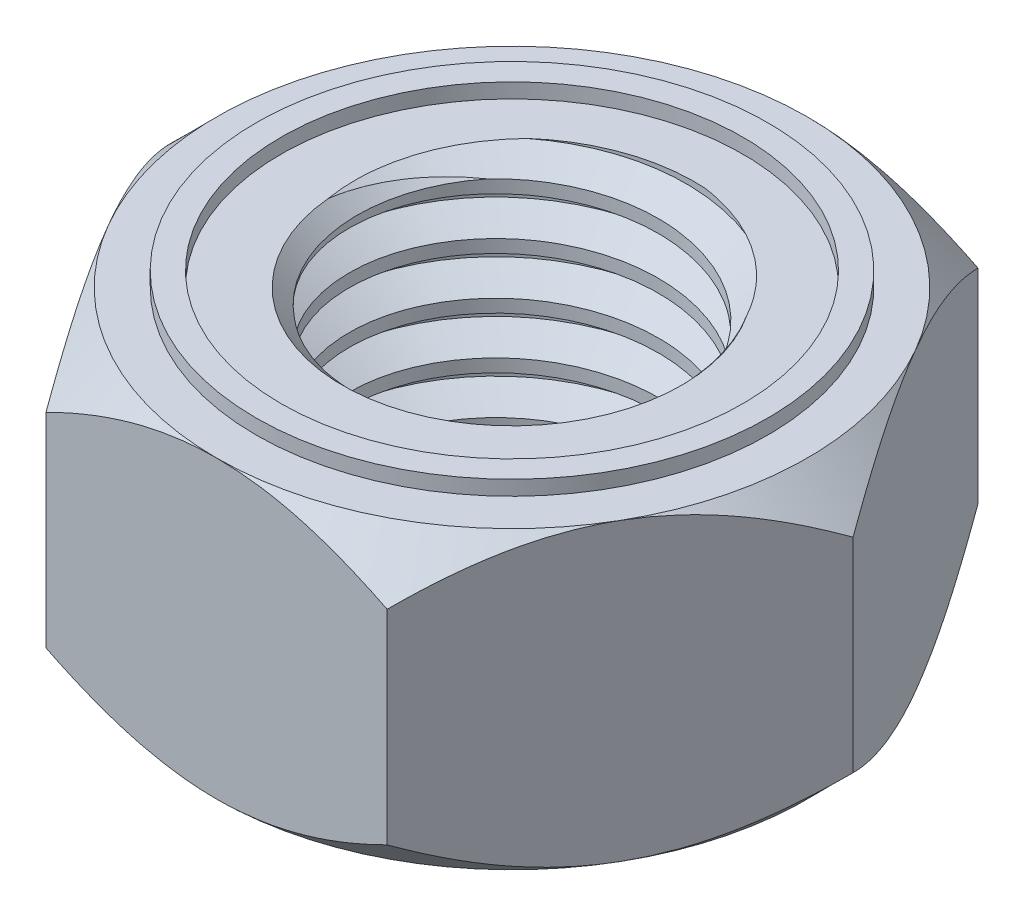
from build123d import *

# Parameters (mm, degrees)
BOSS_EXTRUDE4_DEPTH = 5
SKETCH4_OUTSIDE_W   = 51.524
SKETCH4_OUTSIDE_H   = 48.43
SKETCH4_OUTSIDE_R   = 10
CUT_EXTRUDE2_DEPTH  = 10
CUT_EXTRUDE2_TAPER  = 45
SKETCH5_R           = 5.24
CUT_EXTRUDE3_DEPTH  = 10
CHAMFER1_SIZE       = 0.5
THREAD1_PITCH       = 1.75
SKETCH8_R           = 8.659413975
SKETCH8_R_2         = 7.815938078
BOSS_EXTRUDE6_DEPTH = 0.5


with BuildPart() as part:
    # Sketch1 → Boss-Extrude4 (new, symmetric)
    with BuildSketch(Plane(origin=(0, 0, 0), x_dir=(1, 0, 0), z_dir=(0, 1, 0))):
        Polygon((11.547005384, 0), (5.773502692, 10), (-5.773502692, 10), (-11.547005384, 0), (-5.773502692, -10), (5.773502692, -10), align=None)
    extrude(amount=BOSS_EXTRUDE4_DEPTH, both=True)

    # Sketch4 outside → Cut-Extrude2 (cut)
    with BuildSketch(Plane(origin=(0, 5, 0), x_dir=(1, 0, 0), z_dir=(0, 1, 0))):
        Rectangle(SKETCH4_OUTSIDE_W, SKETCH4_OUTSIDE_H)
        Circle(SKETCH4_OUTSIDE_R, mode=Mode.SUBTRACT)
    cut_extrude2 = extrude(amount=-CUT_EXTRUDE2_DEPTH, taper=CUT_EXTRUDE2_TAPER, mode=Mode.SUBTRACT)

    # Mirror2: Cut-Extrude2 across plane
    add(cut_extrude2.mirror(Plane.ZX), mode=Mode.SUBTRACT)

    # Sketch5 → Cut-Extrude3 (cut)
    with BuildSketch(Plane(origin=(0, 5, 0), x_dir=(1, 0, 0), z_dir=(0, 1, 0))):
        with Locations(Location((0, 0, 0), (0, 0, 270))):
            Circle(SKETCH5_R)
    extrude(amount=-CUT_EXTRUDE3_DEPTH, mode=Mode.SUBTRACT)

    # Chamfer1
    chamfer1_edges = [part.edges().sort_by_distance(p)[0] for p in [
        (0, -5, -5.24),
        (0, 5, -5.24),
    ]]
    chamfer(chamfer1_edges, length=CHAMFER1_SIZE)

    # Thread1: arcs per turn and ends read off the stored shape
    # Thread1: the profile of Thread Profile1 profile screwed along a right-hand helix through 10.857142 turns, 10 arcs to a turn; built about Z, then put on its axis
    thread1_z = Axis((0, 0, 0), (0, 0, 1))
    thread1_corners = [(5.2397, 0, -0.000173205), (6.187215281, 0, 0.546874998), (6.187215281, 0, 0.765624998), (5.2397, 0, 1.3126732)]
    with BuildLine(mode=Mode.PRIVATE) as thread1_profile:
        Line(thread1_corners[0], thread1_corners[1])
        Line(thread1_corners[1], thread1_corners[2])
        Line(thread1_corners[2], thread1_corners[3])
        Line(thread1_corners[3], thread1_corners[0])
    thread1_cap = Face(thread1_profile.wire())
    thread1_turn_angles = [0, 18, 36, 54, 72, 90, 108, 126, 144, 162, 180, 198, 216, 234, 252, 270, 288, 306, 324, 342, 360]
    thread1_turn_weights = [1, 0.9510565162951535, 1, 0.9510565162951535, 1, 0.9510565162951535, 1, 0.9510565162951535, 1, 0.9510565162951535, 1, 0.9510565162951535, 1, 0.9510565162951535, 1, 0.9510565162951535, 1, 0.9510565162951535, 1, 0.9510565162951535, 1]
    thread1_turn_rails = [Edge.make_bspline([Vector(p[0], p[1], 0).rotate(thread1_z, thread1_turn_angles[k]) / thread1_turn_weights[k] + Vector(0, 0, p[2] + THREAD1_PITCH * thread1_turn_angles[k] / 360) for k in range(21)], [0, 0, 0, 1, 1, 2, 2, 3, 3, 4, 4, 5, 5, 6, 6, 7, 7, 8, 8, 9, 9, 10, 10, 10], 2, thread1_turn_weights) for p in thread1_corners]
    thread1_turn_sides = [Face.make_surface_from_curves(thread1_turn_rails[p[0]], thread1_turn_rails[p[1]]) for p in [(0, 1), (1, 2), (2, 3), (3, 0)]]
    thread1_last_angles = [3600, 3618, 3636, 3654, 3672, 3690, 3708, 3726, 3744, 3762, 3780, 3798, 3816, 3834, 3852, 3870, 3888, 3898.2855, 3908.571]
    thread1_last_weights = [1, 0.9510565162951535, 1, 0.9510565162951535, 1, 0.9510565162951535, 1, 0.9510565162951535, 1, 0.9510565162951535, 1, 0.9510565162951535, 1, 0.9510565162951535, 1, 0.9510565162951535, 1, 0.9839302563929734, 1]
    thread1_last_rails = [Edge.make_bspline([Vector(p[0], p[1], 0).rotate(thread1_z, thread1_last_angles[k]) / thread1_last_weights[k] + Vector(0, 0, p[2] + THREAD1_PITCH * thread1_last_angles[k] / 360) for k in range(19)], [0, 0, 0, 1, 1, 2, 2, 3, 3, 4, 4, 5, 5, 6, 6, 7, 7, 8, 8, 9, 9, 9], 2, thread1_last_weights) for p in thread1_corners]
    thread1_last_sides = [Face.make_surface_from_curves(thread1_last_rails[p[0]], thread1_last_rails[p[1]]) for p in [(0, 1), (1, 2), (2, 3), (3, 0)]]
    thread1 = Plane(origin=(0, 9.5, 0), x_dir=(-1, 0, 0), z_dir=(0, -1, 0)) * Solid(Shell([*[p.moved(Location((0, 0, THREAD1_PITCH * i))) for i in range(10) for p in thread1_turn_sides], *thread1_last_sides, thread1_cap, thread1_cap.rotate(thread1_z, 3908.571).moved(Location((0, 0, THREAD1_PITCH * 3908.571 / 360)))]))
    add(thread1, mode=Mode.SUBTRACT)

    # Sketch8 → Boss-Extrude6 (add)
    with BuildSketch(Plane(origin=(0, 5, 0), x_dir=(1, 0, 0), z_dir=(0, 1, 0))):
        with Locations(Location((0, 0, 0), (0, 0, 270))):
            Circle(SKETCH8_R)
        with Locations(Location((0, 0, 0), (0, 0, 270))):
            Circle(SKETCH8_R_2, mode=Mode.SUBTRACT)
    extrude(amount=BOSS_EXTRUDE6_DEPTH)


solid = part.part
